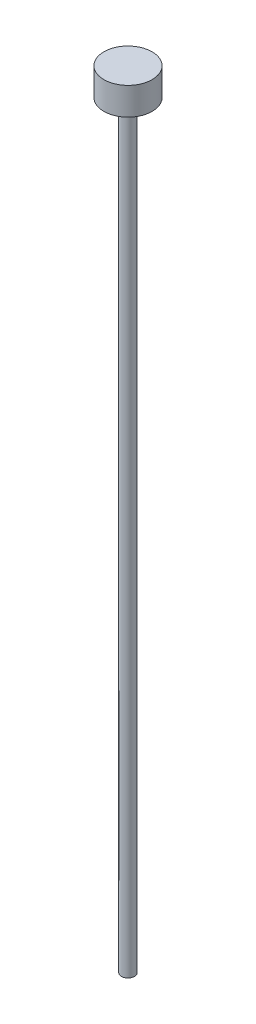
from build123d import *

# Parameters (mm, degrees)
ESBO_O1_R                = 0.95
RESSALTO_EXTRUS_O1_DEPTH = 110
ESBO_O2_R                = 3.5
RESSALTO_EXTRUS_O2_DEPTH = 4
FILETE3_R                = 1


with BuildPart() as part:
    # Esboço1 → Ressalto-extrusão1 (new body)
    with BuildSketch(Plane(origin=(0, 0, 0), x_dir=(1, 0, 0), z_dir=(0, 1, 0))):
        Circle(ESBO_O1_R)
    extrude(amount=RESSALTO_EXTRUS_O1_DEPTH)

    # Esboço2 → Ressalto-extrusão2 (add)
    with BuildSketch(Plane(origin=(0, 110, 0), x_dir=(1, 0, 0), z_dir=(0, 1, 0))):
        Circle(ESBO_O2_R)
    extrude(amount=RESSALTO_EXTRUS_O2_DEPTH)

    # Filete3
    filete3_edges = [part.edges().sort_by_distance(p)[0] for p in [
        (-0.95, 110, 0),
    ]]
    fillet(filete3_edges, radius=FILETE3_R)


solid = part.part
